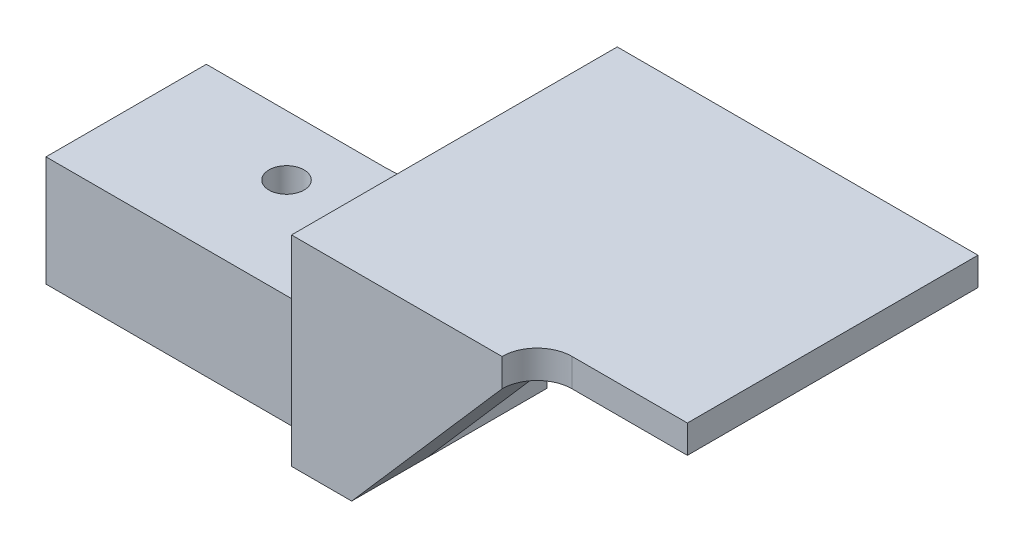
from build123d import *

# Parameters (mm, degrees)
SKETCH_1_W          = 34
SKETCH_1_H          = 16
EXTRUDE_1_DEPTH     = 11
SKETCH_2_W          = 34
SKETCH_2_H          = 3.2
CUT_EXTRUDE_1_DEPTH = 12
HOLE_WIZARD_1_D     = 3.5
SKETCH_6_W          = 6
SKETCH_6_H          = 3.9
EXTRUDE_2_DEPTH     = 13
FILLET_1_R          = 10
SKETCH_7_W          = 6
SKETCH_7_H          = 29
EXTRUDE_3_DEPTH     = 9
SKETCH_8_W          = 29
SKETCH_8_H          = 2.8
EXTRUDE_4_DEPTH     = 30
EXTRUDE_6_DEPTH     = 3.5
FILLET_2_R          = 1
FILLET_3_R          = 3.5
FILLET_4_R          = 3.5
EXTRUDE_7_DEPTH     = 4
SKETCH_12_W         = 0.2
SKETCH_12_H         = 10.1
CUT_EXTRUDE_2_DEPTH = 25


# Some blends are built 0.0001 mm under size
with BuildPart() as part:
    # 草图1 → 凸台-拉伸1 (new body)
    with BuildSketch(Plane(origin=(0, 0, 0), x_dir=(1, 0, 0), z_dir=(0, 1, 0))):
        with Locations((17, -8)):
            Rectangle(SKETCH_1_W, SKETCH_1_H)
    extrude(amount=EXTRUDE_1_DEPTH)

    # 草图2 → 切除-拉伸1 (cut)
    with BuildSketch(Plane(origin=(0, 0, 0), x_dir=(-1, 0, 0), z_dir=(0, 0, -1))):
        with Locations((-17, 5.5)):
            Rectangle(SKETCH_2_W, SKETCH_2_H)
    extrude(amount=-CUT_EXTRUDE_1_DEPTH, mode=Mode.SUBTRACT)

    # 孔1 (through all)
    with Locations(Plane(origin=(0, 11, 0), x_dir=(1, 0, 0), z_dir=(0, 1, 0))):
        with Locations((14, -6)):
            Hole(HOLE_WIZARD_1_D / 2)

    # 草图6 → 凸台-拉伸2 (add)
    with BuildSketch(Plane(origin=(0, 0, 0), x_dir=(-1, 0, 0), z_dir=(0, 0, -1))):
        with Locations((-31, 9.05)):
            Rectangle(SKETCH_6_W, SKETCH_6_H)
    extrude(amount=EXTRUDE_2_DEPTH)

    # 圆角1
    fillet_1_edges = [part.edges().sort_by_distance(p)[0] for p in [
        (28, 9.05, 0),
    ]]
    fillet(fillet_1_edges, radius=FILLET_1_R)

    # 草图7 → 凸台-拉伸3 (add)
    with BuildSketch(Plane(origin=(0, 11, 0), x_dir=(1, 0, 0), z_dir=(0, 1, 0))):
        with Locations((31, -1.5)):
            Rectangle(SKETCH_7_W, SKETCH_7_H)
    extrude(amount=EXTRUDE_3_DEPTH)

    # 草图8 → 凸台-拉伸4 (add)
    with BuildSketch(Plane(origin=(34, 0, 0), x_dir=(0, 0, -1), z_dir=(1, 0, 0))):
        with Locations((-1.5, 18.6)):
            Rectangle(SKETCH_8_W, SKETCH_8_H)
    extrude(amount=EXTRUDE_4_DEPTH)

    # 草图10 → 凸台-拉伸6 (add)
    with BuildSketch(Plane.XY.offset(16)):
        Polygon((28, 0), (34, 0), (34, 17.2), (49, 17.2), (49, 20), (28, 20), (28, 11), align=None)
        Polygon((34, 17.2), (34, 0), (49, 17.2), align=None)
    extrude(amount=EXTRUDE_6_DEPTH)

    # 圆角2
    fillet_2_edges = [part.edges().sort_by_distance(p)[0] for p in [
        (9, 7.1, 0),
        (17, 3.9, 0),
        (28, 7.1, -11.5),
        (25.071067812, 7.1, -2.928932188),
    ]]
    fillet(fillet_2_edges, radius=FILLET_2_R)

    # 圆角3
    fillet_3_edges = [part.edges().sort_by_distance(p)[0] for p in [
        (28, 5.5, 16),
    ]]
    fillet(fillet_3_edges, radius=FILLET_3_R - 0.0001)  # a hair under: the kernel refuses the full size

    # 圆角4
    # the kernel refuses this fillet: 3.5 mm, written as the material it adds along each edge
    with BuildSketch(Plane(origin=(49, 17.2, 16), x_dir=(0, 0, 1), z_dir=(0, 1, 0))) as fillet_4_piece_1:
        with BuildLine():
            CenterArc((FILLET_4_R, FILLET_4_R), FILLET_4_R, 180, 90)
            Line((0, FILLET_4_R), (0, 0))
            Line((0, 0), (FILLET_4_R, 0))
        make_face()
    extrude(amount=2.8)

    # 草图11 → 凸台-拉伸7 (add)
    with BuildSketch(Plane(origin=(0, 0, 16), x_dir=(-1, 0, 0), z_dir=(0, 0, -1))):
        Polygon((-49, 17.2), (-34, 17.2), (-34, 0), align=None)
    extrude(amount=EXTRUDE_7_DEPTH)

    # 草图12 → 切除-拉伸2 (cut)
    with BuildSketch(Plane(origin=(0, 0, -13), x_dir=(-1, 0, 0), z_dir=(0, 0, -1))):
        with Locations((-33.9, 12.15)):
            Rectangle(SKETCH_12_W, SKETCH_12_H)
    extrude(amount=-CUT_EXTRUDE_2_DEPTH, mode=Mode.SUBTRACT)


solid = part.part
